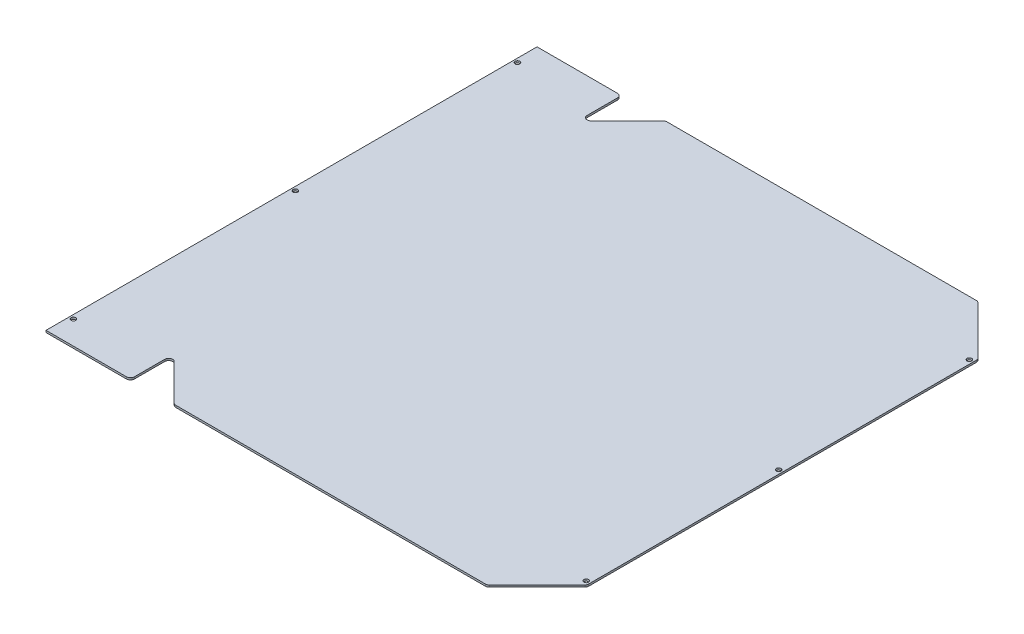
from build123d import *

# Parameters (mm, degrees)
BOSS_EXTRUDE1_DEPTH   = 1.5875
F_6_CLEARANCE_HOLE1_D = 3.7973
FILLET1_R             = 3.175


with BuildPart() as part:
    # Sketch1 → Boss-Extrude1 (new body)
    with BuildSketch(Plane(origin=(0, 0, 0), x_dir=(1, 0, 0), z_dir=(0, 1, 0))):
        Polygon((199.39, 158.75), (158.75, 199.39), (-95.25, 199.39), (-130.81, 163.83), (-130.81, 199.39), (-199.39, 199.39), (-199.39, -199.39), (-130.81, -199.39), (-130.81, -163.83), (-95.25, -199.39), (158.75, -199.39), (199.39, -158.75), align=None)
    extrude(amount=-BOSS_EXTRUDE1_DEPTH)

    # #6 Clearance Hole1 (through all)
    with Locations(Plane(origin=(0, -1.5875, 0), x_dir=(-1, 0, 0), z_dir=(0, -1, 0))):
        with Locations((196.215, 180.34), (196.215, -180.34), (-196.215, -156.21), (-196.215, 154.94), (196.215, 0), (-196.215, 0)):
            Hole(F_6_CLEARANCE_HOLE1_D / 2)

    # Fillet1
    fillet1_edges = [part.edges().sort_by_distance(p)[0] for p in [
        (158.75, -0.79375, -199.39),
        (199.39, -0.79375, -158.75),
        (199.39, -0.79375, 158.75),
        (158.75, -0.79375, 199.39),
        (-130.81, -0.79375, 163.83),
        (-130.81, -0.79375, 199.39),
        (-95.25, -0.79375, 199.39),
        (-95.25, -0.79375, -199.39),
        (-130.81, -0.79375, -199.39),
        (-130.81, -0.79375, -163.83),
    ]]
    fillet(fillet1_edges, radius=FILLET1_R)


solid = part.part
